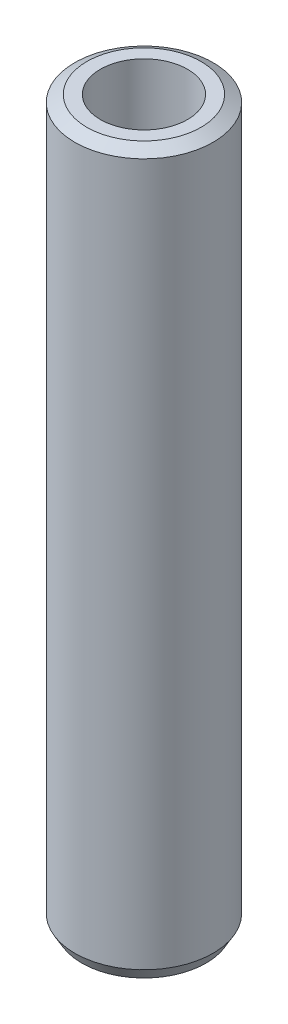
from build123d import *
from OCP.BRepFilletAPI import BRepFilletAPI_MakeChamfer

# Parameters (mm, degrees)
SKETCH1_R           = 57.5
BOSS_EXTRUDE1_DEPTH = 600
SKETCH2_R           = 36.274228348
CUT_EXTRUDE1_DEPTH  = 606.485342515
CHAMFER1_SIZE       = 5.790357586
CHAMFER1_SIZE2      = 10.029193533


with BuildPart() as part:
    # Sketch1 → Boss-Extrude1 (new body)
    with BuildSketch(Plane(origin=(0, 0, 0), x_dir=(1, 0, 0), z_dir=(0, 1, 0))):
        Circle(SKETCH1_R)
    extrude(amount=BOSS_EXTRUDE1_DEPTH)

    # Sketch2 → Cut-Extrude1 (cut, through all)
    with BuildSketch(Plane(origin=(0, 0, 0), x_dir=(1, 0, 0), z_dir=(0, 1, 0))):
        Circle(SKETCH2_R)
    extrude(amount=CUT_EXTRUDE1_DEPTH, mode=Mode.SUBTRACT)

    # Chamfer1: one chamfer whose edges measure the first distance from different faces: ONE call of the kernel's chamfer builder (chamfer() names one face for all edges)
    chamfer1_edges_1 = [part.edges().sort_by_distance(p)[0] for p in [
        (-57.5, 600, 0),
    ]]
    chamfer1_side_1 = [part.faces().sort_by_distance(p)[0] for p in [
        (-57.5, 300, 0),
    ]]
    chamfer1_edges_2 = [part.edges().sort_by_distance(p)[0] for p in [
        (-57.5, 0, 0),
    ]]
    chamfer1_side_2 = [part.faces().sort_by_distance(p)[0] for p in [
        (-55.873654403, 0, 0),
    ]]
    chamfer1 = BRepFilletAPI_MakeChamfer(part.part.solid().wrapped)
    for e in chamfer1_edges_1:
        chamfer1.Add(CHAMFER1_SIZE, CHAMFER1_SIZE2, e.wrapped, chamfer1_side_1[0].wrapped)  # the first distance lies on this face
    for e in chamfer1_edges_2:
        chamfer1.Add(CHAMFER1_SIZE, CHAMFER1_SIZE2, e.wrapped, chamfer1_side_2[0].wrapped)  # the first distance lies on this face
    add(Compound.cast(chamfer1.Shape()), mode=Mode.REPLACE)


solid = part.part
